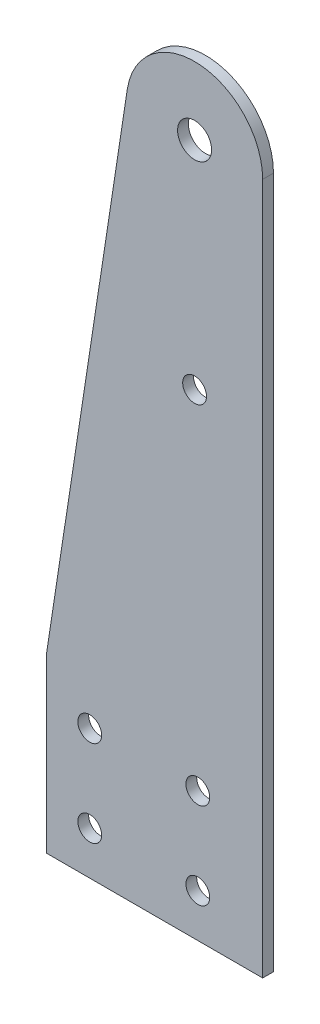
from build123d import *

# Parameters (mm, degrees)
SKETCH1_R           = 5
SKETCH1_R_2         = 3.5
BOSS_EXTRUDE1_DEPTH = 3.175


with BuildPart() as part:
    # Sketch1 → Boss-Extrude1 (new body)
    with BuildSketch(Plane.XY):
        with BuildLine():
            Line((-31.75, -25.4), (31.75, -25.4))
            Line((31.75, -25.4), (31.75, 177.8))
            ThreePointArc((31.75, 177.8), (13.263638058, 197.742640242), (-8.020889983, 180.818593926))
            Line((-8.020889983, 180.818593926), (-31.75, 25.4))
            Line((-31.75, 25.4), (-31.75, -25.4))
        make_face()
        with Locations((11.75, 177.8)):
            Circle(SKETCH1_R, mode=Mode.SUBTRACT)
        with Locations((-19.05, 12.7)):
            Circle(SKETCH1_R_2, mode=Mode.SUBTRACT)
        with Locations((12.7, 12.7)):
            Circle(SKETCH1_R_2, mode=Mode.SUBTRACT)
        with Locations((12.7, -12.7)):
            Circle(SKETCH1_R_2, mode=Mode.SUBTRACT)
        with Locations((-19.05, -12.7)):
            Circle(SKETCH1_R_2, mode=Mode.SUBTRACT)
        with Locations((11.75, 114.3)):
            Circle(SKETCH1_R_2, mode=Mode.SUBTRACT)
    extrude(amount=BOSS_EXTRUDE1_DEPTH)


solid = part.part
